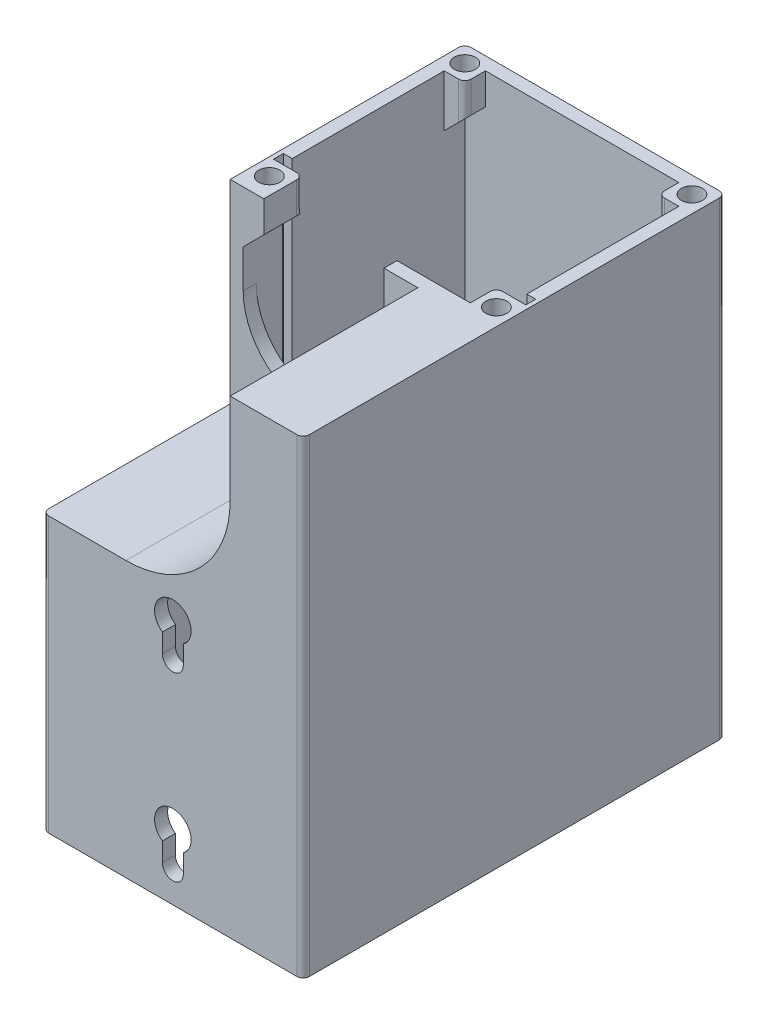
from build123d import *

# Parameters (mm, degrees)
SKETCH_1_W          = 50
SKETCH_1_H          = 45
SKETCH_1_W_2        = 45
SKETCH_1_H_2        = 40
EXTRUDE_1_DEPTH     = 90
SKETCH_2_W          = 48.4
SKETCH_2_H          = 1.9
CUT_EXTRUDE_1_DEPTH = 36
SKETCH_3_R          = 13.5
CUT_EXTRUDE_2_DEPTH = 2.5
EXTRUDE_2_DEPTH     = 36
SKETCH_5_W          = 45
SKETCH_5_H          = 36
CUT_EXTRUDE_3_DEPTH = 50.2
CUT_EXTRUDE_4_DEPTH = 36
SKETCH_7_W          = 2.2
SKETCH_7_H          = 1.9
EXTRUDE_3_DEPTH     = 30
CHAMFER_1_SIZE      = 2.2
SKETCH_8_W          = 3.95
SKETCH_8_H          = 3.95
EXTRUDE_4_DEPTH     = 6
SKETCH_9_R          = 2.025
CUT_EXTRUDE_5_DEPTH = 5
SKETCH_10_W         = 3.95
SKETCH_10_H         = 5
SKETCH_10_H_2       = 7.5
SKETCH_10_H_3       = 3.95
EXTRUDE_5_DEPTH     = 6
CUT_EXTRUDE_START   = -5
SKETCH_11_R         = 2.025
CUT_EXTRUDE_6_DEPTH = 5
CHAMFER_2_SIZE      = 3.95
FILLET_1_R          = 1.2
CUT_EXTRUDE_7_REACH = 125.637


with BuildPart() as part:
    # 草圖1 → 填料-伸長1 (new body)
    with BuildSketch(Plane(origin=(0, 0, 0), x_dir=(1, 0, 0), z_dir=(0, 1, 0))):
        Rectangle(SKETCH_1_W, SKETCH_1_H)
        Rectangle(SKETCH_1_W_2, SKETCH_1_H_2, mode=Mode.SUBTRACT)
    extrude(amount=-EXTRUDE_1_DEPTH)

    # 草圖2 → 除料-伸長1 (cut)
    with BuildSketch(Plane(origin=(0, 0, 0), x_dir=(1, 0, 0), z_dir=(0, 1, 0))):
        with Locations((0, -14.05)):
            Rectangle(SKETCH_2_W, SKETCH_2_H)
    extrude(amount=-CUT_EXTRUDE_1_DEPTH, mode=Mode.SUBTRACT)

    # 草圖3 → 除料-伸長2 (cut)
    with BuildSketch(Plane.XY.offset(22.5)):
        with BuildLine():
            Line((-22.5, 0), (-22.5, -17.3))
            ThreePointArc((-22.5, -17.3), (-9, -3.8), (4.5, -17.3))
            Line((4.5, -17.3), (4.5, 0))
            Line((4.5, 0), (-22.5, 0))
        make_face()
        with Locations((-9, -17.3)):
            Circle(SKETCH_3_R)
    extrude(amount=-CUT_EXTRUDE_2_DEPTH, mode=Mode.SUBTRACT)

    # 草圖4 → 填料-伸長2 (add)
    with BuildSketch(Plane.XY.offset(22.5)):
        with BuildLine():
            Line((11, 0), (11, -17.3))
            ThreePointArc((11, -17.3), (5.142135624, -31.442135624), (-9, -37.3))
            Line((-9, -37.3), (-25, -37.3))
            Line((-25, -37.3), (-25, -90))
            Line((-25, -90), (25, -90))
            Line((25, -90), (25, 0))
            Line((25, 0), (11, 0))
        make_face()
    extrude(amount=EXTRUDE_2_DEPTH)

    # 草圖5 → 除料-伸長3 (cut)
    with BuildSketch(Plane(origin=(-25, -90, 58.5), x_dir=(1, 0, 0), z_dir=(0, -1, 0))):
        with Locations((25, -20.5)):
            Rectangle(SKETCH_5_W, SKETCH_5_H)
    extrude(amount=-CUT_EXTRUDE_3_DEPTH, mode=Mode.SUBTRACT)

    # 草圖6 → 除料-伸長4 (cut)
    with BuildSketch(Plane(origin=(0, 0, 20), x_dir=(-1, 0, 0), z_dir=(0, 0, -1))):
        with BuildLine():
            Line((-22.5, -2.5), (-22.5, -39.8))
            Line((-22.5, -39.8), (9, -39.8))
            ThreePointArc((9, -39.8), (-6.909902577, -33.209902577), (-13.5, -17.3))
            Line((-13.5, -17.3), (-13.5, -2.5))
            Line((-13.5, -2.5), (-22.5, -2.5))
        make_face()
    extrude(amount=-CUT_EXTRUDE_4_DEPTH, mode=Mode.SUBTRACT)

    # 草圖7 → 填料-伸長3 (add)
    with BuildSketch(Plane(origin=(0, -38.5, 0), x_dir=(1, 0, 0), z_dir=(0, 1, 0))):
        with Locations((-21.4, -14.05)):
            Rectangle(SKETCH_7_W, SKETCH_7_H)
    extrude(amount=-EXTRUDE_3_DEPTH)

    # 導角1
    chamfer_1_edges = [part.edges().sort_by_distance(p)[0] for p in [
        (-20.3, -38.5, 14.05),
        (-20.3, -68.5, 14.05),
    ]]
    chamfer(chamfer_1_edges, length=CHAMFER_1_SIZE - 0.0001)  # a hair under: the kernel refuses the full size

    # 草圖8 → 填料-伸長4 (add)
    with BuildSketch(Plane.XZ.offset(90)):
        with Locations((-20.525, 54.025)):
            Rectangle(SKETCH_8_W, SKETCH_8_H)
        with Locations((20.525, 54.025)):
            Rectangle(SKETCH_8_W, SKETCH_8_H)
        with Locations((20.525, -18.025)):
            Rectangle(SKETCH_8_W, SKETCH_8_H)
        with Locations((-20.525, -18.025)):
            Rectangle(SKETCH_8_W, SKETCH_8_H)
    extrude(amount=-EXTRUDE_4_DEPTH)

    # 草圖9 → 除料-伸長5 (cut)
    with BuildSketch(Plane.XZ.offset(90)):
        with Locations(Location((-21.775, 55.275, 0), (0, 0, 270))):
            Circle(SKETCH_9_R)
        with Locations(Location((21.775, 55.275, 0), (0, 0, 270))):
            Circle(SKETCH_9_R)
        with Locations(Location((-21.775, -19.275, 0), (0, 0, 270))):
            Circle(SKETCH_9_R)
        with Locations(Location((21.775, -19.275, 0), (0, 0, 270))):
            Circle(SKETCH_9_R)
    extrude(amount=-CUT_EXTRUDE_5_DEPTH, mode=Mode.SUBTRACT)

    # 草圖10 → 填料-伸長5 (add)
    with BuildSketch(Plane(origin=(0, 0, 0), x_dir=(1, 0, 0), z_dir=(0, 1, 0))):
        with Locations((20.525, -17.5)):
            Rectangle(SKETCH_10_W, SKETCH_10_H)
        with Locations((-20.525, -18.75)):
            Rectangle(SKETCH_10_W, SKETCH_10_H_2)
        with Locations((-20.525, 18.025)):
            Rectangle(SKETCH_10_W, SKETCH_10_H_3)
        with Locations((20.525, 18.025)):
            Rectangle(SKETCH_10_W, SKETCH_10_H_3)
    extrude(amount=-EXTRUDE_5_DEPTH)

    # 草圖11 → 除料-伸長6 (cut)
    with BuildSketch(Plane(origin=(0, 0, 0), x_dir=(1, 0, 0), z_dir=(0, 1, 0)).offset(CUT_EXTRUDE_START)):
        with Locations(Location((21.775, -18.225, 0), (0, 0, 270))):
            Circle(SKETCH_11_R)
        with Locations(Location((-21.775, -18.225, 0), (0, 0, 270))):
            Circle(SKETCH_11_R)
        with Locations(Location((21.775, 19.275, 0), (0, 0, 90))):
            Circle(SKETCH_11_R)
        with Locations(Location((-21.775, 19.275, 0), (0, 0, 90))):
            Circle(SKETCH_11_R)
    extrude(amount=CUT_EXTRUDE_6_DEPTH, mode=Mode.SUBTRACT)

    # 導角2
    chamfer_2_edges = [part.edges().sort_by_distance(p)[0] for p in [
        (-22.5, -6, 18.75),
        (22.5, -6, 17.5),
        (22.5, -6, -18.025),
        (-22.5, -6, -18.025),
    ]]
    chamfer(chamfer_2_edges, length=CHAMFER_2_SIZE - 0.0001)  # a hair under: the kernel refuses the full size

    # 圓角1
    fillet_1_edges = [part.edges().sort_by_distance(p)[0] for p in [
        (-18.55, -87, 52.05),
        (18.55, -87, 52.05),
        (18.55, -87, -16.05),
        (-18.55, -87, -16.05),
        (-18.55, -3, 15),
        (18.55, -3, 15),
        (-18.55, -3, -16.05),
        (18.55, -3, -16.05),
        (-25, -45, -22.5),
        (-25, -63.65, 58.5),
        (25, -45, 58.5),
        (25, -45, -22.5),
    ]]
    fillet(fillet_1_edges, radius=FILLET_1_R)

    # 草圖12 → 除料-伸長7 (cut, up to next)
    with BuildSketch(Plane.XY.offset(58.5), mode=Mode.PRIVATE) as cut_extrude_7_sk1:
        with BuildLine():
            Line((-2, -49.3), (-2, -45.672281323))
            ThreePointArc((-2, -45.672281323), (0, -39.3), (2, -45.672281323))
            Line((2, -45.672281323), (2, -49.3))
            ThreePointArc((2, -49.3), (0, -51.3), (-2, -49.3))
        make_face()
    cut_extrude_7_tool1 = extrude(cut_extrude_7_sk1.sketch, amount=-CUT_EXTRUDE_7_REACH, mode=Mode.PRIVATE) & part.part
    # 草圖12 → 除料-伸長7 (cut, up to next)
    with BuildSketch(Plane.XY.offset(58.5), mode=Mode.PRIVATE) as cut_extrude_7_sk2:
        with BuildLine():
            Line((-2, -84), (-2, -80.372281323))
            ThreePointArc((-2, -80.372281323), (0, -74), (2, -80.372281323))
            Line((2, -80.372281323), (2, -84))
            ThreePointArc((2, -84), (0, -86), (-2, -84))
        make_face()
    cut_extrude_7_tool2 = extrude(cut_extrude_7_sk2.sketch, amount=-CUT_EXTRUDE_7_REACH, mode=Mode.PRIVATE) & part.part
    add(cut_extrude_7_tool1.solids().sort_by_distance((0, -44.69051, 58.5))[0], mode=Mode.SUBTRACT)
    add(cut_extrude_7_tool2.solids().sort_by_distance((0, -79.39051, 58.5))[0], mode=Mode.SUBTRACT)


solid = part.part
